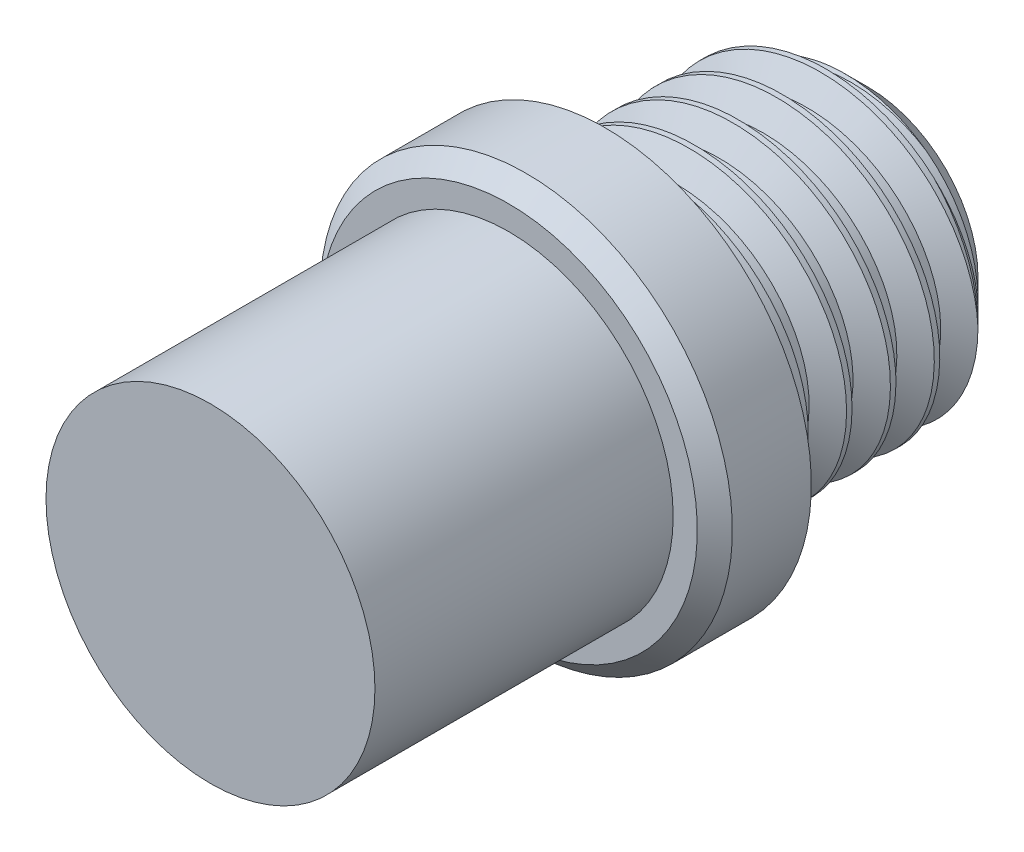
from build123d import *

# Parameters (mm, degrees)
CHAMFER1_SIZE = 1
THREAD1_PITCH = 1


with BuildPart() as part:
    # Sketch2 → Revolve1 (revolve)
    with BuildSketch(Plane(origin=(0, 0, 0), x_dir=(1, 0, 0), z_dir=(0, 1, 0)), mode=Mode.PRIVATE) as revolve1_sk:
        Polygon((0, 0), (3.75, 0), (3.75, 6.8), (4.3, 6.8), (4.7, 7.2), (4.7, 9), (3.5, 9), (3.5, 15), (2.25, 15), (2.25, 6), (0, 6), align=None)
    revolve(revolve1_sk.sketch.rotate(Axis((0, 0, -6), (0, 0, 1)), 180), axis=Axis((0, 0, -6), (0, 0, 1)))

    # Chamfer1
    chamfer1_edges = [part.edges().sort_by_distance(p)[0] for p in [
        (3.5, 0, -15),
    ]]
    chamfer(chamfer1_edges, length=CHAMFER1_SIZE)

    # Thread1: the profile of Thread Profile1 profile screwed along a right-hand helix of 4.5 turns, 8 arcs to a turn; built about Z, then put on its axis
    thread1_z = Axis((0, 0, 0), (0, 0, 1))
    thread1_corners = [(3.5003, 0, -0.000173205), (3.5003, 0, 0.875173202), (2.958734125, 0, 0.562499999), (2.958734125, 0, 0.312499999)]
    with BuildLine(mode=Mode.PRIVATE) as thread1_profile:
        Line(thread1_corners[0], thread1_corners[1])
        Line(thread1_corners[1], thread1_corners[2])
        Line(thread1_corners[2], thread1_corners[3])
        Line(thread1_corners[3], thread1_corners[0])
    thread1_cap = Face(thread1_profile.wire())
    thread1_turn_angles = [0, 22.5, 45, 67.5, 90, 112.5, 135, 157.5, 180, 202.5, 225, 247.5, 270, 292.5, 315, 337.5, 360]
    thread1_turn_weights = [1, 0.9238795325112867, 1, 0.9238795325112867, 1, 0.9238795325112867, 1, 0.9238795325112867, 1, 0.9238795325112867, 1, 0.9238795325112867, 1, 0.9238795325112867, 1, 0.9238795325112867, 1]
    thread1_turn_rails = [Edge.make_bspline([Vector(p[0], p[1], 0).rotate(thread1_z, thread1_turn_angles[k]) / thread1_turn_weights[k] + Vector(0, 0, p[2] + THREAD1_PITCH * thread1_turn_angles[k] / 360) for k in range(17)], [0, 0, 0, 1, 1, 2, 2, 3, 3, 4, 4, 5, 5, 6, 6, 7, 7, 8, 8, 8], 2, thread1_turn_weights) for p in thread1_corners]
    thread1_turn_sides = [Face.make_surface_from_curves(thread1_turn_rails[p[0]], thread1_turn_rails[p[1]]) for p in [(0, 1), (1, 2), (2, 3), (3, 0)]]
    thread1_last_angles = [1440, 1462.5, 1485, 1507.5, 1530, 1552.5, 1575, 1597.5, 1620]
    thread1_last_weights = [1, 0.9238795325112867, 1, 0.9238795325112867, 1, 0.9238795325112867, 1, 0.9238795325112966, 1]
    thread1_last_rails = [Edge.make_bspline([Vector(p[0], p[1], 0).rotate(thread1_z, thread1_last_angles[k]) / thread1_last_weights[k] + Vector(0, 0, p[2] + THREAD1_PITCH * thread1_last_angles[k] / 360) for k in range(9)], [0, 0, 0, 1, 1, 2, 2, 3, 3, 4, 4, 4], 2, thread1_last_weights) for p in thread1_corners]
    thread1_last_sides = [Face.make_surface_from_curves(thread1_last_rails[p[0]], thread1_last_rails[p[1]]) for p in [(0, 1), (1, 2), (2, 3), (3, 0)]]
    thread1 = Plane(origin=(0, 0, -15), x_dir=(1, 0, 0), z_dir=(0, 0, 1)) * Solid(Shell([*[p.moved(Location((0, 0, THREAD1_PITCH * i))) for i in range(4) for p in thread1_turn_sides], *thread1_last_sides, thread1_cap, thread1_cap.rotate(thread1_z, 1620).moved(Location((0, 0, THREAD1_PITCH * 1620 / 360)))]))
    add(thread1, mode=Mode.SUBTRACT)


solid = part.part
